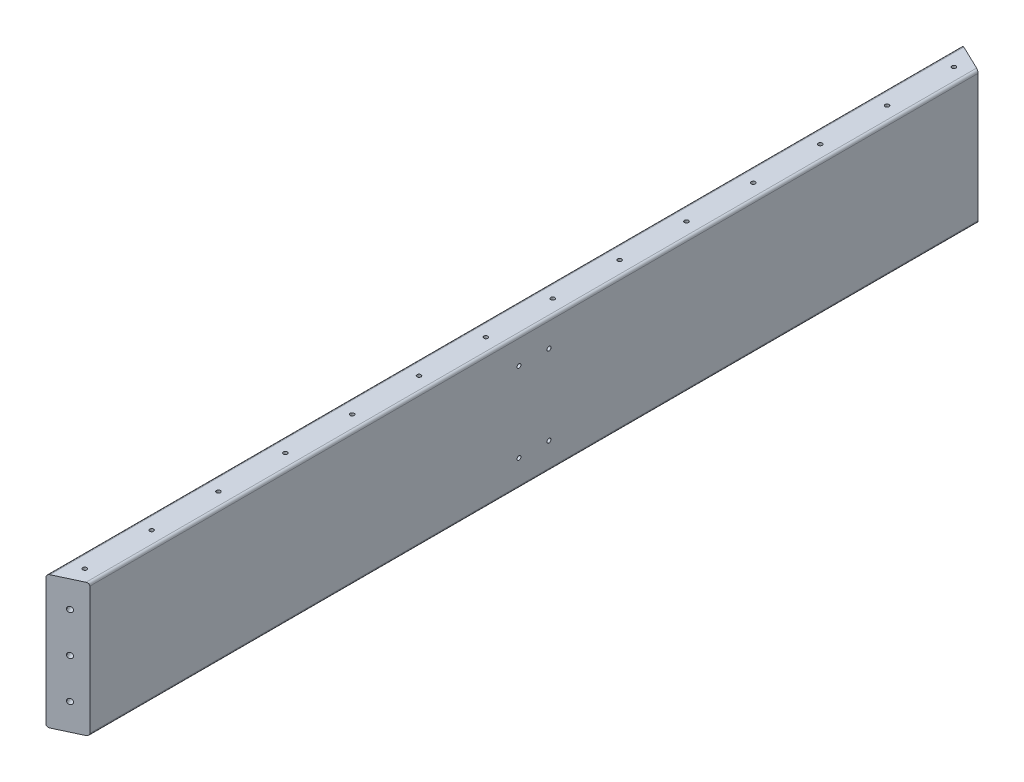
from build123d import *

# Parameters (mm, degrees)
SKETCH1_W                       = 45
SKETCH1_H                       = 200
BOSS_EXTRUDE1_DEPTH             = 1380
FILLET1_R                       = 4
CUT_EXTRUDE2_DEPTH              = 1395.76618373
CUT_EXTRUDE2_DEPTH_BACK         = 1395.76618373
CUT_EXTRUDE3_DEPTH              = 1
SKETCH5_W                       = 1040
SKETCH5_H                       = 12.18939795
CUT_EXTRUDE4_DEPTH              = 5
CUT_EXTRUDE6_DEPTH              = 1395.766183831
CUT_EXTRUDE6_DEPTH_BACK         = 1395.766183831
F_6_0MM_DOWEL_SLOT1_D           = 6
F_6_0MM_DOWEL_SLOT1_DEPTH       = 23.197418143
F_6_0MM_DOWEL_SLOT1_CSINK_D     = 6.05
F_6_0MM_DOWEL_SLOT1_CSINK_ANGLE = 90
F_6_0MM_DOWEL_SLOT1_TIP         = 1.802581857


# Read off the part's stored shape, not the designer's step: Mirror2
with BuildPart() as part:
    # Sketch1 → Boss-Extrude1 (new body)
    with BuildSketch(Plane.XY):
        with Locations((-8.688255411, 34.272684877)):
            Rectangle(SKETCH1_W, SKETCH1_H)
    extrude(amount=BOSS_EXTRUDE1_DEPTH)

    # Fillet1
    fillet1_edges = [part.edges().sort_by_distance(p)[0] for p in [
        (13.811744589, 134.272684877, 690),
        (13.811744589, -65.727315123, 690),
        (-31.188255411, -65.727315123, 690),
        (-31.188255411, 134.272684877, 690),
    ]]
    fillet(fillet1_edges, radius=FILLET1_R)

    # Sketch3 → Cut-Extrude2 (cut, two sides: drawn at the far end of the back side and taken through both)
    with BuildSketch(Plane(origin=(0, 134.272684877, 0), x_dir=(1, 0, 0), z_dir=(0, 1, 0)).offset(-CUT_EXTRUDE2_DEPTH_BACK)):
        Polygon((-2540.235466027, -2557.162450526), (-31.188255411, -1380), (13.811744589, -1358.887479658), (2522.858955205, -181.725029131), (4877.183856257, -5199.819450363), (-185.910564974, -7575.256871758), align=None)
    extrude(amount=CUT_EXTRUDE2_DEPTH + CUT_EXTRUDE2_DEPTH_BACK, mode=Mode.SUBTRACT)

    # Sketch4 → Cut-Extrude3 (cut)
    # profile 1 of 10: a face of its own
    with BuildSketch(Plane.ZY.offset(31.188255411)):
        Polygon((209.169849176, 65.068842021), (189.182870009, 51.344883687), (168.740161676, 16.136550354), (182.711515843, 5.068842021), (124.000578343, 5.068842021), (137.984953343, 17.152175354), (122.945890843, 42.516758687), (109.156828343, 16.136550354), (121.149015843, 5.068842021), (62.477140843, 5.068842021), (75.484953343, 16.136550354), (52.333911676, 53.284987854), (35.328703343, 65.068842021), (95.315682509, 65.068842021), (81.604745009, 53.284987854), (96.930265843, 30.342279521), (110.211515843, 53.284987854), (96.800057509, 65.068842021), (157.620370009, 65.068842021), (143.128182509, 55.277175354), (158.766203343, 32.555821187), (172.125578343, 55.277175354), (160.615161676, 65.068842021), align=None)
    # profile 2 of 10: a face of its own
    with BuildSketch(Plane.ZY.offset(31.188255411)):
        with BuildLine():
            add(Edge.make_bspline(
                [(264.326099176, 66.735508687), (266.189227903, 66.707980657), (269.861125556, 66.65372777), (275.26915309, 66.150572474), (280.495274351, 65.38382248), (285.534693329, 64.27657962), (290.382639072, 62.839432273), (295.053069981, 61.109591829), (299.526819942, 59.048480687), (303.083679686, 57.069242922), (305.790650375, 55.376164216), (307.688829496, 54.067814238), (309.452049225, 52.733194099), (311.093381559, 51.372418159), (312.596750517, 49.985653024), (313.978029894, 48.575152909), (315.212306424, 47.123605596), (316.338320509, 45.659033747), (317.322520534, 44.152878865), (318.160808805, 42.614050033), (318.907091707, 41.062433651), (319.484481342, 39.471506305), (319.94922533, 37.85859476), (320.270814969, 36.216174167), (320.474101215, 34.544449378), (320.498658509, 33.420115885), (320.510995009, 32.855300354)],
                knots=[0, 0, 0, 0, 1.870629373, 3.686680101, 5.449679929, 7.172461936, 8.863314668, 10.523861725, 12.169900943, 13.804909445, 14.607911283, 15.375655432, 16.119264063, 16.828024649, 17.515890728, 18.172441472, 18.809264666, 19.428220604, 20.026654656, 20.613855905, 21.187108478, 21.753895089, 22.311302344, 22.871209158, 23.432945294, 24, 24, 24, 24], degree=3))
            add(Edge.make_bspline(
                [(320.510995009, 32.855300354), (320.498284656, 32.329586723), (320.472985865, 31.283202049), (320.275114115, 29.726136043), (319.931701863, 28.204241908), (319.472053853, 26.706254068), (318.89196957, 25.232621105), (318.147875781, 23.795143936), (317.294273692, 22.375809285), (316.295278658, 20.992036112), (315.172195641, 19.635798815), (313.918278771, 18.306374587), (312.533171949, 17.005338997), (311.023417615, 15.722272405), (309.359690696, 14.497476901), (307.58841739, 13.263170069), (305.675627608, 12.069537072), (302.936694019, 10.526844348), (299.346396048, 8.711044174), (294.810886977, 6.861224241), (290.092614822, 5.260623141), (285.167189764, 3.98402574), (280.056691695, 2.959158768), (274.741243537, 2.255617424), (269.229469352, 1.814187634), (265.485808634, 1.76201435), (263.583911676, 1.735508687)],
                knots=[0, 0, 0, 0, 0.535886334, 1.066632505, 1.596991156, 2.124684857, 2.66290463, 3.20910542, 3.772963408, 4.350121154, 4.947287965, 5.567109047, 6.211950874, 6.883915627, 7.585726949, 8.317291323, 9.084662034, 9.883255442, 11.521815987, 13.182578758, 14.872965808, 16.597765281, 18.366385382, 20.183745168, 22.061222958, 24, 24, 24, 24], degree=3))
            add(Edge.make_bspline(
                [(263.583911676, 1.735508687), (261.716673374, 1.761052498), (258.03323332, 1.811441938), (252.595146569, 2.269782714), (247.325843852, 2.993181321), (242.226128826, 4.001883389), (237.305218505, 5.324131554), (232.550826222, 6.921153297), (227.974555453, 8.832241904), (224.305306248, 10.641226402), (221.525049358, 12.228659397), (219.566143591, 13.424151458), (217.741219479, 14.643059631), (216.062147013, 15.898912747), (214.50000951, 17.159272162), (213.086543348, 18.459285042), (211.800977044, 19.778352384), (210.652532814, 21.122067608), (209.629664775, 22.486754401), (208.760119809, 23.8857084), (208.006173349, 25.293828785), (207.407946386, 26.734919081), (206.934838212, 28.197841854), (206.598254767, 29.688063922), (206.378470837, 31.199441331), (206.355709451, 32.216529429), (206.344328343, 32.725092021)],
                knots=[0, 0, 0, 0, 1.90415575, 3.756265899, 5.561801141, 7.32679303, 9.054558052, 10.755431149, 12.438304469, 14.10920509, 14.924040824, 15.703010382, 16.44950419, 17.161341954, 17.840970712, 18.495796147, 19.118783714, 19.718499511, 20.297533784, 20.8564013, 21.396999339, 21.924813045, 22.445599886, 22.96321623, 23.481589214, 24, 24, 24, 24], degree=3))
            add(Edge.make_bspline(
                [(206.344328343, 32.725092021), (206.354951838, 33.303126758), (206.376030168, 34.450019189), (206.602965272, 36.1496044), (206.914520353, 37.821558238), (207.398509769, 39.458281726), (207.984805784, 41.072238765), (208.745502466, 42.643309668), (209.611205942, 44.192672728), (210.623365762, 45.706651548), (211.758834351, 47.19726042), (213.035675348, 48.652434511), (214.450007013, 50.072454265), (215.984681152, 51.467972035), (217.665866159, 52.82229066), (219.463803932, 54.165216321), (221.420012125, 55.447285142), (224.180150019, 57.158663337), (227.840127609, 59.118230775), (232.452161279, 61.143894604), (237.257577537, 62.89233514), (242.281850532, 64.281942507), (247.501615246, 65.400787681), (252.927595044, 66.166583874), (258.557699387, 66.650504606), (262.380639558, 66.706840077), (264.326099176, 66.735508687)],
                knots=[0, 0, 0, 0, 0.566000994, 1.123015997, 1.677639493, 2.230826392, 2.793269511, 3.358231105, 3.938993238, 4.53108876, 5.140939044, 5.77382598, 6.426367607, 7.103766969, 7.805130735, 8.540850176, 9.301609764, 10.095898195, 11.722665968, 13.363905004, 15.027949392, 16.72841623, 18.467455848, 20.254861266, 22.094132828, 24, 24, 24, 24], degree=3))
        make_face()
        with BuildLine():
            add(Edge.make_bspline(
                [(263.427661676, 56.735508687), (262.662855701, 56.719612589), (261.16235635, 56.688425483), (258.968616765, 56.396208455), (256.879103121, 55.914215716), (254.899188276, 55.235939489), (253.021575316, 54.377176671), (251.264073737, 53.306245653), (249.603277278, 52.057785842), (248.079431933, 50.609893379), (246.683607353, 49.033514321), (245.479688121, 47.313730901), (244.465983425, 45.48681972), (243.619580671, 43.553742361), (242.97499783, 41.505072326), (242.502506736, 39.344604905), (242.228620683, 37.07246286), (242.194864363, 35.52096507), (242.177661676, 34.730300354)],
                knots=[0, 0, 0, 0, 1.068019417, 2.095384312, 3.085239948, 4.059332961, 5.014309867, 5.963726676, 6.929042446, 7.91134787, 8.895298759, 9.865932067, 10.837682145, 11.809829407, 12.808909193, 13.832922564, 14.895627388, 16, 16, 16, 16], degree=3))
            add(Edge.make_bspline(
                [(242.177661676, 34.730300354), (242.194392443, 33.943890735), (242.227128157, 32.405187788), (242.50527584, 30.160735422), (242.958298915, 28.037061152), (243.59942989, 26.030374967), (244.420329781, 24.142260954), (245.409268696, 22.364587383), (246.612871835, 20.729519997), (247.970692222, 19.213346988), (249.480467402, 17.840817777), (251.12774913, 16.657568242), (252.886455842, 15.640845579), (254.767430481, 14.82554492), (256.76393267, 14.180302369), (258.880128058, 13.731537606), (261.115443506, 13.451289652), (262.645559381, 13.418788149), (263.427661676, 13.402175354)],
                knots=[0, 0, 0, 0, 1.111633912, 2.175042541, 3.192181049, 4.178126016, 5.148360161, 6.099125499, 7.048007327, 8.012791551, 8.973017082, 9.926867274, 10.875332242, 11.839940779, 12.820042915, 13.837181423, 14.894498514, 16, 16, 16, 16], degree=3))
            add(Edge.make_bspline(
                [(263.427661676, 13.402175354), (264.214126695, 13.418556325), (265.748628362, 13.450517856), (267.992282569, 13.732888109), (270.117282759, 14.18017181), (272.117420013, 14.822726981), (274.003192374, 15.632034001), (275.758632761, 16.638659129), (277.405961093, 17.818170028), (278.905865932, 19.183382295), (280.263345488, 20.696597077), (281.455806472, 22.336861571), (282.443752251, 24.113403608), (283.278228272, 25.995334403), (283.892042463, 28.014219046), (284.350210602, 30.143149145), (284.628556392, 32.396574075), (284.66102354, 33.939573732), (284.677661676, 34.730300354)],
                knots=[0, 0, 0, 0, 1.110699014, 2.167126888, 3.189404377, 4.174520152, 5.130247132, 6.083235944, 7.027723808, 7.987141777, 8.94245558, 9.895503572, 10.845469305, 11.809266594, 12.798381888, 13.820659378, 14.883173667, 16, 16, 16, 16], degree=3))
            add(Edge.make_bspline(
                [(284.677661676, 34.730300354), (284.662530746, 35.521240076), (284.632912001, 37.069501919), (284.331585729, 39.328932953), (283.882450935, 41.484360847), (283.238244194, 43.531066899), (282.372645433, 45.456962908), (281.365481939, 47.292520289), (280.143806614, 49.003188271), (278.750686728, 50.584337778), (277.226197497, 52.032211184), (275.561849281, 53.279276851), (273.808168856, 54.362930436), (271.939064943, 55.238667062), (269.956704738, 55.900036252), (267.872889094, 56.379898909), (265.68534442, 56.69208543), (264.188290172, 56.7208791), (263.427661676, 56.735508687)],
                knots=[0, 0, 0, 0, 1.105324758, 2.163669494, 3.181353393, 4.181294546, 5.156718352, 6.129306234, 7.104276847, 8.08907606, 9.072228388, 10.038376414, 10.991765335, 11.950124574, 12.917358406, 13.908067456, 14.937123684, 16, 16, 16, 16], degree=3))
        make_face(mode=Mode.SUBTRACT)
    # profile 3 of 10: a face of its own
    with BuildSketch(Plane.ZY.offset(31.188255411)):
        with BuildLine():
            add(Edge.make_bspline(
                [(384.326099176, 66.735508687), (386.189227903, 66.707980657), (389.861125556, 66.65372777), (395.26915309, 66.150572474), (400.495274351, 65.38382248), (405.534693329, 64.27657962), (410.382639072, 62.839432273), (415.053069981, 61.109591829), (419.526819942, 59.048480687), (423.083679686, 57.069242922), (425.790650375, 55.376164216), (427.688829496, 54.067814238), (429.452049225, 52.733194099), (431.093381559, 51.372418159), (432.596750517, 49.985653024), (433.978029894, 48.575152909), (435.212306424, 47.123605596), (436.338320509, 45.659033747), (437.322520534, 44.152878865), (438.160808805, 42.614050033), (438.907091707, 41.062433651), (439.484481342, 39.471506305), (439.94922533, 37.85859476), (440.270814969, 36.216174167), (440.474101215, 34.544449378), (440.498658509, 33.420115885), (440.510995009, 32.855300354)],
                knots=[0, 0, 0, 0, 1.870629373, 3.686680101, 5.449679929, 7.172461936, 8.863314668, 10.523861725, 12.169900943, 13.804909445, 14.607911283, 15.375655432, 16.119264063, 16.828024649, 17.515890728, 18.172441472, 18.809264666, 19.428220604, 20.026654656, 20.613855905, 21.187108478, 21.753895089, 22.311302344, 22.871209158, 23.432945294, 24, 24, 24, 24], degree=3))
            add(Edge.make_bspline(
                [(440.510995009, 32.855300354), (440.498284656, 32.329586723), (440.472985865, 31.283202049), (440.275114115, 29.726136043), (439.931701863, 28.204241908), (439.472053853, 26.706254068), (438.89196957, 25.232621105), (438.147875781, 23.795143936), (437.294273692, 22.375809285), (436.295278658, 20.992036112), (435.172195641, 19.635798815), (433.918278771, 18.306374587), (432.533171949, 17.005338997), (431.023417615, 15.722272405), (429.359690696, 14.497476901), (427.58841739, 13.263170069), (425.675627608, 12.069537072), (422.936694019, 10.526844348), (419.346396048, 8.711044174), (414.810886977, 6.861224241), (410.092614822, 5.260623141), (405.167189764, 3.98402574), (400.056691695, 2.959158768), (394.741243537, 2.255617424), (389.229469352, 1.814187634), (385.485808634, 1.76201435), (383.583911676, 1.735508687)],
                knots=[0, 0, 0, 0, 0.535886334, 1.066632505, 1.596991156, 2.124684857, 2.66290463, 3.20910542, 3.772963408, 4.350121154, 4.947287965, 5.567109047, 6.211950874, 6.883915627, 7.585726949, 8.317291323, 9.084662034, 9.883255442, 11.521815987, 13.182578758, 14.872965808, 16.597765281, 18.366385382, 20.183745168, 22.061222958, 24, 24, 24, 24], degree=3))
            add(Edge.make_bspline(
                [(383.583911676, 1.735508687), (381.716673374, 1.761052498), (378.03323332, 1.811441938), (372.595146569, 2.269782714), (367.325843852, 2.993181321), (362.226128826, 4.001883389), (357.305218505, 5.324131554), (352.550826222, 6.921153297), (347.974555453, 8.832241904), (344.305306248, 10.641226402), (341.525049358, 12.228659397), (339.566143591, 13.424151458), (337.741219479, 14.643059631), (336.062147013, 15.898912747), (334.50000951, 17.159272162), (333.086543348, 18.459285042), (331.800977044, 19.778352384), (330.652532814, 21.122067608), (329.629664775, 22.486754401), (328.760119809, 23.8857084), (328.006173349, 25.293828785), (327.407946386, 26.734919081), (326.934838212, 28.197841854), (326.598254767, 29.688063922), (326.378470837, 31.199441331), (326.355709451, 32.216529429), (326.344328343, 32.725092021)],
                knots=[0, 0, 0, 0, 1.90415575, 3.756265899, 5.561801141, 7.32679303, 9.054558052, 10.755431149, 12.438304469, 14.10920509, 14.924040824, 15.703010382, 16.44950419, 17.161341954, 17.840970712, 18.495796147, 19.118783714, 19.718499511, 20.297533784, 20.8564013, 21.396999339, 21.924813045, 22.445599886, 22.96321623, 23.481589214, 24, 24, 24, 24], degree=3))
            add(Edge.make_bspline(
                [(326.344328343, 32.725092021), (326.354951838, 33.303126758), (326.376030168, 34.450019189), (326.602965272, 36.1496044), (326.914520353, 37.821558238), (327.398509769, 39.458281726), (327.984805784, 41.072238765), (328.745502466, 42.643309668), (329.611205942, 44.192672728), (330.623365762, 45.706651548), (331.758834351, 47.19726042), (333.035675348, 48.652434511), (334.450007013, 50.072454265), (335.984681152, 51.467972035), (337.665866159, 52.82229066), (339.463803932, 54.165216321), (341.420012125, 55.447285142), (344.180150019, 57.158663337), (347.840127609, 59.118230775), (352.452161279, 61.143894604), (357.257577537, 62.89233514), (362.281850532, 64.281942507), (367.501615246, 65.400787681), (372.927595044, 66.166583874), (378.557699387, 66.650504606), (382.380639558, 66.706840077), (384.326099176, 66.735508687)],
                knots=[0, 0, 0, 0, 0.566000994, 1.123015997, 1.677639493, 2.230826392, 2.793269511, 3.358231105, 3.938993238, 4.53108876, 5.140939044, 5.77382598, 6.426367607, 7.103766969, 7.805130735, 8.540850176, 9.301609764, 10.095898195, 11.722665968, 13.363905004, 15.027949392, 16.72841623, 18.467455848, 20.254861266, 22.094132828, 24, 24, 24, 24], degree=3))
        make_face()
        with BuildLine():
            add(Edge.make_bspline(
                [(383.427661676, 56.735508687), (382.662855701, 56.719612589), (381.16235635, 56.688425483), (378.968616765, 56.396208455), (376.879103121, 55.914215716), (374.899188276, 55.235939489), (373.021575316, 54.377176671), (371.264073737, 53.306245653), (369.603277278, 52.057785842), (368.079431933, 50.609893379), (366.683607353, 49.033514321), (365.479688121, 47.313730901), (364.465983425, 45.48681972), (363.619580671, 43.553742361), (362.97499783, 41.505072326), (362.502506736, 39.344604905), (362.228620683, 37.07246286), (362.194864363, 35.52096507), (362.177661676, 34.730300354)],
                knots=[0, 0, 0, 0, 1.068019417, 2.095384312, 3.085239948, 4.059332961, 5.014309867, 5.963726676, 6.929042446, 7.91134787, 8.895298759, 9.865932067, 10.837682145, 11.809829407, 12.808909193, 13.832922564, 14.895627388, 16, 16, 16, 16], degree=3))
            add(Edge.make_bspline(
                [(362.177661676, 34.730300354), (362.194392443, 33.943890735), (362.227128157, 32.405187788), (362.50527584, 30.160735422), (362.958298915, 28.037061152), (363.59942989, 26.030374967), (364.420329781, 24.142260954), (365.409268696, 22.364587383), (366.612871835, 20.729519997), (367.970692222, 19.213346988), (369.480467402, 17.840817777), (371.12774913, 16.657568242), (372.886455842, 15.640845579), (374.767430481, 14.82554492), (376.76393267, 14.180302369), (378.880128058, 13.731537606), (381.115443506, 13.451289652), (382.645559381, 13.418788149), (383.427661676, 13.402175354)],
                knots=[0, 0, 0, 0, 1.111633912, 2.175042541, 3.192181049, 4.178126016, 5.148360161, 6.099125499, 7.048007327, 8.012791551, 8.973017082, 9.926867274, 10.875332242, 11.839940779, 12.820042915, 13.837181423, 14.894498514, 16, 16, 16, 16], degree=3))
            add(Edge.make_bspline(
                [(383.427661676, 13.402175354), (384.214126695, 13.418556325), (385.748628362, 13.450517856), (387.992282569, 13.732888109), (390.117282759, 14.18017181), (392.117420013, 14.822726981), (394.003192374, 15.632034001), (395.758632761, 16.638659129), (397.405961093, 17.818170028), (398.905865932, 19.183382295), (400.263345488, 20.696597077), (401.455806472, 22.336861571), (402.443752251, 24.113403608), (403.278228272, 25.995334403), (403.892042463, 28.014219046), (404.350210602, 30.143149145), (404.628556392, 32.396574075), (404.66102354, 33.939573732), (404.677661676, 34.730300354)],
                knots=[0, 0, 0, 0, 1.110699014, 2.167126888, 3.189404377, 4.174520152, 5.130247132, 6.083235944, 7.027723808, 7.987141777, 8.94245558, 9.895503572, 10.845469305, 11.809266594, 12.798381888, 13.820659378, 14.883173667, 16, 16, 16, 16], degree=3))
            add(Edge.make_bspline(
                [(404.677661676, 34.730300354), (404.662530746, 35.521240076), (404.632912001, 37.069501919), (404.331585729, 39.328932953), (403.882450935, 41.484360847), (403.238244194, 43.531066899), (402.372645433, 45.456962908), (401.365481939, 47.292520289), (400.143806614, 49.003188271), (398.750686728, 50.584337778), (397.226197497, 52.032211184), (395.561849281, 53.279276851), (393.808168856, 54.362930436), (391.939064943, 55.238667062), (389.956704738, 55.900036252), (387.872889094, 56.379898909), (385.68534442, 56.69208543), (384.188290172, 56.7208791), (383.427661676, 56.735508687)],
                knots=[0, 0, 0, 0, 1.105324758, 2.163669494, 3.181353393, 4.181294546, 5.156718352, 6.129306234, 7.104276847, 8.08907606, 9.072228388, 10.038376414, 10.991765335, 11.950124574, 12.917358406, 13.908067456, 14.937123684, 16, 16, 16, 16], degree=3))
        make_face(mode=Mode.SUBTRACT)
    # profile 4 of 10: a face of its own
    with BuildSketch(Plane.ZY.offset(31.188255411)):
        with BuildLine():
            Line((443.492765843, 65.068842021), (522.190682509, 65.068842021))
            add(Edge.make_bspline(
                [(522.190682509, 65.068842021), (523.293178189, 65.065104661), (525.433474218, 65.057849254), (528.555008138, 64.965724661), (531.489675525, 64.810502582), (534.246256318, 64.600623025), (536.823644946, 64.352669886), (539.215278292, 64.010283745), (541.425873143, 63.620143205), (544.145037082, 63.038943314), (547.41324665, 62.03981434), (551.248647502, 60.491777115), (555.037029754, 58.525086517), (557.455088082, 56.951802983), (558.688078343, 56.149571187)],
                knots=[0, 0, 0, 0, 1.037536368, 2.014189271, 2.938623327, 3.802961405, 4.615839976, 5.374884088, 6.075983965, 6.728149891, 7.990680596, 9.286214146, 10.616215543, 12, 12, 12, 12], degree=3))
            add(Edge.make_bspline(
                [(558.688078343, 56.149571187), (559.26889564, 55.737725161), (560.412148874, 54.927066966), (562.034480024, 53.651002587), (563.54801046, 52.36295854), (564.948887779, 51.056809832), (566.231869726, 49.732807509), (567.414933291, 48.398902163), (568.480756052, 47.04747464), (569.440277117, 45.677757705), (570.266965829, 44.282782297), (571.004977291, 42.882531096), (571.634858233, 41.468436912), (572.12842296, 40.023412583), (572.517137774, 38.569758891), (572.809683538, 37.100867465), (572.983442856, 35.615626299), (573.001802151, 34.61790149), (573.010995009, 34.118321187)],
                knots=[0, 0, 0, 0, 1.249054469, 2.458579603, 3.619872382, 4.735112552, 5.81752881, 6.853380763, 7.86188952, 8.835705453, 9.785129533, 10.704770048, 11.611712122, 12.497925602, 13.380861412, 14.250029463, 15.123755567, 16, 16, 16, 16], degree=3))
            add(Edge.make_bspline(
                [(573.010995009, 34.118321187), (573.003751182, 33.588149977), (572.989396746, 32.537557714), (572.790132634, 30.981444626), (572.516040435, 29.459310402), (572.099495184, 27.979298366), (571.601635507, 26.526668908), (570.953237291, 25.123164306), (570.211693877, 23.749052709), (569.350155537, 22.412937303), (568.353730689, 21.134242756), (567.267862885, 19.869261323), (566.06049972, 18.648468691), (564.721117851, 17.481262632), (563.290187002, 16.328983243), (561.73597683, 15.224002112), (560.06691241, 14.155765671), (557.666760458, 12.777462214), (554.463201159, 11.179890898), (550.359588051, 9.539705264), (545.980290655, 8.16951812), (541.338174357, 7.019796552), (536.418256861, 6.140345746), (531.226714689, 5.526987488), (525.764217343, 5.141751251), (522.030751102, 5.093521004), (520.120370009, 5.068842021)],
                knots=[0, 0, 0, 0, 0.57437755, 1.138191963, 1.698381788, 2.249747293, 2.803357062, 3.361408448, 3.92359075, 4.495263514, 5.082544895, 5.679696615, 6.301906837, 6.941991075, 7.604846679, 8.29297448, 9.008269995, 9.752421165, 11.292811579, 12.884851517, 14.538218337, 16.263790688, 18.066384255, 19.952737707, 21.92905229, 24, 24, 24, 24], degree=3))
            Line((520.120370009, 5.068842021), (443.492765843, 5.068842021))
            Line((443.492765843, 5.068842021), (465.510995009, 18.805821187))
            Line((465.510995009, 18.805821187), (465.510995009, 51.162592021))
            Line((465.510995009, 51.162592021), (443.492765843, 65.068842021))
        make_face()
        with BuildLine():
            Line((496.344328343, 16.735508687), (511.070890843, 16.735508687))
            add(Edge.make_bspline(
                [(511.070890843, 16.735508687), (512.329699209, 16.745064771), (514.735531377, 16.763328339), (518.18068647, 16.912044251), (521.289869154, 17.188067913), (524.074907712, 17.536182108), (526.528754627, 18.01427895), (528.662162707, 18.589885512), (530.471434238, 19.268392613), (531.991682458, 20.070388675), (533.242866553, 21.073398949), (534.312703567, 22.264130557), (535.212045813, 23.673101279), (535.94407692, 25.296130043), (536.493518615, 27.13275332), (536.891199575, 29.178029579), (537.141156529, 31.434212429), (537.165161558, 33.010857686), (537.177661676, 33.831862854)],
                knots=[0, 0, 0, 0, 1.64779172, 3.149256418, 4.512366556, 5.732937362, 6.821548936, 7.782276976, 8.622159497, 9.346745673, 10.021984238, 10.709915122, 11.433275169, 12.20111891, 13.033201691, 13.936846005, 14.925655543, 16, 16, 16, 16], degree=3))
            add(Edge.make_bspline(
                [(537.177661676, 33.831862854), (537.157841538, 34.657430346), (537.119418626, 36.257858488), (536.817501244, 38.583472107), (536.312651217, 40.747594934), (535.61512438, 42.759199676), (534.688960756, 44.598395789), (533.584083373, 46.288835145), (532.265517293, 47.815740533), (530.741406454, 49.178961537), (529.009470796, 50.376152365), (527.082927811, 51.426147176), (524.94704649, 52.290116207), (522.620079529, 53.004955218), (520.094080024, 53.560940147), (517.366436971, 53.961710372), (514.434305533, 54.193098126), (512.412453546, 54.221084315), (511.370370009, 54.235508687)],
                knots=[0, 0, 0, 0, 1.053932644, 2.043132125, 2.988170456, 3.887375669, 4.754852068, 5.611030817, 6.459823452, 7.323253996, 8.214964486, 9.142484795, 10.119185202, 11.151698555, 12.247550536, 13.418522366, 14.669479586, 16, 16, 16, 16], degree=3))
            Line((511.370370009, 54.235508687), (496.344328343, 54.235508687))
            Line((496.344328343, 54.235508687), (496.344328343, 16.735508687))
        make_face(mode=Mode.SUBTRACT)
    # profile 5 of 10: a face of its own
    with BuildSketch(Plane.ZY.offset(31.188255411)):
        with BuildLine():
            Line((576.826099176, 65.068842021), (655.953703343, 65.068842021))
            add(Edge.make_bspline(
                [(655.953703343, 65.068842021), (657.486320072, 65.053416713), (660.484912737, 65.023236815), (664.872939517, 64.727159612), (669.054926719, 64.268278826), (673.02339065, 63.605393817), (676.781186129, 62.763771501), (680.327745784, 61.734889536), (683.66495648, 60.518251955), (686.281849273, 59.324247555), (688.243733753, 58.291933443), (689.611837499, 57.503081246), (690.879739479, 56.674038566), (692.065185984, 55.837189674), (693.148328892, 54.958689669), (694.142547994, 54.06586894), (695.029329186, 53.130639274), (695.841342081, 52.187771998), (696.550639494, 51.202722618), (697.157243976, 50.188689827), (697.687070916, 49.158113066), (698.106809546, 48.092890701), (698.422818608, 47.000740349), (698.687691396, 45.887181589), (698.805797049, 44.741511794), (698.831459372, 43.970905503), (698.844328343, 43.584467021)],
                knots=[0, 0, 0, 0, 2.105049813, 4.118568463, 6.038489211, 7.882189377, 9.642475769, 11.32546917, 12.951418585, 14.517567808, 15.272314675, 15.99631609, 16.68591711, 17.352664789, 17.98863279, 18.600645991, 19.186788513, 19.757817292, 20.308823715, 20.851771583, 21.379715788, 21.898970077, 22.42150002, 22.940788537, 23.468833728, 24, 24, 24, 24], degree=3))
            add(Edge.make_bspline(
                [(698.844328343, 43.584467021), (698.817241562, 42.878237154), (698.764069365, 41.491885875), (698.254129644, 39.479132409), (697.458001507, 37.579268776), (696.315655133, 35.80173951), (694.84885596, 34.153642968), (693.070627146, 32.625825825), (690.979929747, 31.215844139), (688.582020531, 29.942794219), (685.914065525, 28.786260152), (682.986444065, 27.789077961), (679.814331426, 26.945248946), (676.398521863, 26.267266979), (672.745701314, 25.712992596), (668.845715591, 25.35322958), (664.702484512, 25.108931552), (661.856865226, 25.082454853), (660.393807509, 25.068842021)],
                knots=[0, 0, 0, 0, 0.721701506, 1.41672259, 2.111516441, 2.822652028, 3.568681228, 4.36236042, 5.216309961, 6.14459493, 7.137493147, 8.189830915, 9.30738106, 10.494965799, 11.752859852, 13.087483236, 14.502547355, 16, 16, 16, 16], degree=3))
            Line((660.393807509, 25.068842021), (629.677661676, 25.068842021))
            Line((629.677661676, 25.068842021), (629.677661676, 19.274571187))
            Line((629.677661676, 19.274571187), (651.656828343, 5.068842021))
            Line((651.656828343, 5.068842021), (576.826099176, 5.068842021))
            Line((576.826099176, 5.068842021), (598.844328343, 19.274571187))
            Line((598.844328343, 19.274571187), (598.844328343, 51.136550354))
            Line((598.844328343, 51.136550354), (576.826099176, 65.068842021))
        make_face()
        with BuildLine():
            Line((629.677661676, 36.735508687), (652.529224176, 36.735508687))
            add(Edge.make_bspline(
                [(652.529224176, 36.735508687), (653.154417295, 36.73820209), (654.353454026, 36.743367677), (656.076499067, 36.845911487), (657.65115886, 36.960833958), (659.07545196, 37.161603219), (660.357684266, 37.397746079), (661.485749371, 37.714663782), (662.475850384, 38.052908688), (663.313330544, 38.479119839), (664.0416665, 38.97116023), (664.661341388, 39.551491435), (665.183833879, 40.22597889), (665.614021229, 40.978332955), (665.936471956, 41.832864817), (666.188698479, 42.759952968), (666.309799138, 43.785367788), (666.33247274, 44.491359066), (666.344328343, 44.860508687)],
                knots=[0, 0, 0, 0, 1.627966544, 3.122221958, 4.494697369, 5.738471256, 6.866914578, 7.88711769, 8.7882005, 9.586970752, 10.326944841, 11.070708394, 11.787525129, 12.541865667, 13.318574242, 14.160341201, 15.038076858, 16, 16, 16, 16], degree=3))
            add(Edge.make_bspline(
                [(666.344328343, 44.860508687), (666.334180262, 45.203835296), (666.314287871, 45.876828282), (666.163319443, 46.855358217), (665.87987571, 47.759757304), (665.521648137, 48.60900068), (665.028232053, 49.37434397), (664.457894133, 50.093804367), (663.749037595, 50.714862593), (662.958541173, 51.294933562), (662.041649323, 51.786172038), (661.033864685, 52.228854938), (659.911702201, 52.592411606), (658.692102949, 52.88660292), (657.365855957, 53.120885104), (655.935874332, 53.290610466), (654.396526553, 53.374055322), (653.336593424, 53.392603843), (652.789640843, 53.402175354)],
                knots=[0, 0, 0, 0, 0.910007037, 1.783806841, 2.613556051, 3.417214628, 4.218399135, 5.019748818, 5.842369397, 6.707645606, 7.61386336, 8.592746744, 9.62230475, 10.735613351, 11.915859863, 13.19014394, 14.550042466, 16, 16, 16, 16], degree=3))
            Line((652.789640843, 53.402175354), (629.677661676, 53.402175354))
            Line((629.677661676, 53.402175354), (629.677661676, 36.735508687))
        make_face(mode=Mode.SUBTRACT)
    # profile 6 of 10: a face of its own
    with BuildSketch(Plane.ZY.offset(31.188255411)):
        Polygon((818.010995009, 65.068842021), (818.010995009, 38.844883687), (795.550057509, 55.068842021), (753.010995009, 55.068842021), (753.010995009, 41.735508687), (776.396411676, 41.735508687), (793.010995009, 49.352696187), (793.010995009, 21.852696187), (776.396411676, 30.068842021), (753.010995009, 30.068842021), (753.010995009, 16.735508687), (795.550057509, 16.735508687), (819.677661676, 33.962071187), (819.677661676, 5.068842021), (700.159432509, 5.068842021), (722.177661676, 18.766758687), (722.177661676, 51.253737854), (700.159432509, 65.068842021), align=None)
    # profile 7 of 10: a face of its own
    with BuildSketch(Plane.ZY.offset(31.188255411)):
        with BuildLine():
            Line((935.510995009, 66.084467021), (935.510995009, 38.180821187))
            add(Edge.make_bspline(
                [(935.510995009, 38.180821187), (934.926387354, 38.905649198), (933.763318111, 40.347684994), (931.845724847, 42.350553648), (929.836754932, 44.230750831), (927.695318403, 45.947519308), (925.47641531, 47.562195135), (923.117881812, 49.005100821), (920.655158299, 50.317925183), (918.091782945, 51.511823188), (915.404201563, 52.530508094), (912.6214739, 53.455557767), (909.71114474, 54.196826985), (906.701892771, 54.828398292), (903.579973085, 55.303919739), (900.348354067, 55.65665228), (897.002577208, 55.868555712), (894.734390248, 55.890861384), (893.583911676, 55.902175354)],
                knots=[0, 0, 0, 0, 0.946210828, 1.882474, 2.815915731, 3.741314916, 4.670670766, 5.603695327, 6.549165255, 7.506583431, 8.475882905, 9.469282938, 10.485896633, 11.526843182, 12.593876876, 13.694522957, 14.830607007, 16, 16, 16, 16], degree=3))
            add(Edge.make_bspline(
                [(893.583911676, 55.902175354), (892.450619495, 55.889176448), (890.254924544, 55.86399174), (887.067648632, 55.613611964), (884.101173288, 55.203951671), (881.350936094, 54.631689622), (878.816242805, 53.911616143), (876.497841711, 53.015634149), (874.40405973, 51.945108512), (872.521600701, 50.720484213), (870.866698724, 49.313304681), (869.423237376, 47.749164127), (868.21458178, 46.005296915), (867.221083448, 44.107731027), (866.447160809, 42.043342376), (865.912861777, 39.817057836), (865.558157941, 37.43261105), (865.527025827, 35.786343842), (865.510995009, 34.938633687)],
                knots=[0, 0, 0, 0, 1.361526538, 2.637887207, 3.838606771, 4.957579928, 6.010636943, 7.001387485, 7.939021657, 8.83149138, 9.693578116, 10.542550991, 11.381663369, 12.235444155, 13.110137342, 14.023378089, 14.982180744, 16, 16, 16, 16], degree=3))
            add(Edge.make_bspline(
                [(865.510995009, 34.938633687), (865.530349527, 34.090726211), (865.567863365, 32.44727203), (865.945514463, 30.082217484), (866.521399959, 27.890489923), (867.361211592, 25.885570578), (868.433507749, 24.050801624), (869.765216545, 22.416151483), (871.318287096, 20.950380477), (873.130997499, 19.676027482), (875.215923092, 18.584278647), (877.573700725, 17.639364815), (880.220911665, 16.829349166), (883.164639952, 16.200833224), (886.396169888, 15.671960018), (889.922769833, 15.319932852), (893.742069537, 15.116649339), (896.383128608, 15.085150855), (897.750578343, 15.068842021)],
                knots=[0, 0, 0, 0, 0.942106099, 1.826034385, 2.656094526, 3.456497988, 4.235368595, 5.010957713, 5.792813081, 6.602949612, 7.466551927, 8.4039861, 9.423760577, 10.540850867, 11.748446455, 13.063302589, 14.47947888, 16, 16, 16, 16], degree=3))
            add(Edge.make_bspline(
                [(897.750578343, 15.068842021), (899.061784587, 15.081883473), (901.630215109, 15.107429464), (905.396781542, 15.364856503), (909.000715161, 15.758857131), (912.43406832, 16.331975391), (915.705596615, 17.057299185), (918.801904086, 17.95385003), (921.736266668, 19.008997939), (924.46852262, 20.219538842), (926.954490902, 21.537440468), (929.115603757, 22.955438168), (930.938743009, 24.438467362), (932.405356193, 26.007403724), (933.525933745, 27.656860183), (934.301950118, 29.38427988), (934.713648969, 31.20401034), (934.689707918, 32.432488544), (934.677661676, 33.050612854)],
                knots=[0, 0, 0, 0, 1.402726314, 2.747702809, 4.037471048, 5.280364341, 6.470102412, 7.620855566, 8.727004207, 9.803942215, 10.815763112, 11.734099946, 12.565340187, 13.32445359, 14.023830686, 14.689137373, 15.340422928, 16, 16, 16, 16], degree=3))
            add(Edge.make_bspline(
                [(934.677661676, 33.050612854), (934.65475122, 33.175359159), (934.597929601, 33.48475007), (934.403232171, 33.734747583), (934.287036676, 33.883946187)],
                knots=[0, 0, 0, 0, 0.806399288, 2, 2, 2, 2], degree=3))
            add(Edge.make_bspline(
                [(934.287036676, 33.883946187), (934.649285884, 33.66299838), (935.354037331, 33.233147098), (936.27650514, 32.455981875), (937.074190417, 31.627660463), (937.735605652, 30.72740474), (938.228732591, 29.741907691), (938.582635558, 28.694600691), (938.815862689, 27.583464788), (938.834716975, 26.814834236), (938.844328343, 26.423008687)],
                knots=[0, 0, 0, 0, 1.105509158, 2.150754673, 3.13582401, 4.100642831, 5.052620013, 5.997907561, 6.979391378, 8, 8, 8, 8], degree=3))
            add(Edge.make_bspline(
                [(938.844328343, 26.423008687), (938.834601453, 25.966822626), (938.815367315, 25.064751559), (938.653185289, 23.727924866), (938.392630781, 22.421918096), (938.032290021, 21.14818375), (937.552934694, 19.910420307), (936.985336019, 18.707970732), (936.315174888, 17.533546636), (935.527962018, 16.402796513), (934.643786276, 15.294998492), (933.651057188, 14.224738491), (932.549646202, 13.200859922), (931.365363292, 12.18729892), (930.055560228, 11.23080288), (928.653889882, 10.294228493), (927.145470048, 9.391382091), (924.977658107, 8.223489898), (922.071683096, 6.875511254), (918.341619835, 5.4995021), (914.356446489, 4.3309114), (910.105463266, 3.38538782), (905.596857558, 2.648053622), (900.824788285, 2.122914331), (895.793582345, 1.787927141), (892.351823239, 1.753262333), (890.589120009, 1.735508687)],
                knots=[0, 0, 0, 0, 0.552058771, 1.091651601, 1.627445518, 2.162930235, 2.691775597, 3.232313983, 3.771241375, 4.326490976, 4.898393428, 5.485796368, 6.091636368, 6.71793022, 7.371527852, 8.053482174, 8.758091527, 9.498592092, 11.033537906, 12.631109767, 14.306895306, 16.056953907, 17.899302752, 19.834254757, 21.866505944, 24, 24, 24, 24], degree=3))
            add(Edge.make_bspline(
                [(890.589120009, 1.735508687), (888.548451985, 1.762453872), (884.531926072, 1.815488483), (878.615672817, 2.250570734), (872.917129827, 2.976217525), (867.434365225, 3.990592339), (862.167036449, 5.288891398), (857.116442466, 6.877370407), (852.280937411, 8.754288163), (848.435993351, 10.564234229), (845.521319696, 12.137907726), (843.471366535, 13.32748575), (841.576659986, 14.569404031), (839.805558313, 15.813823391), (838.196356854, 17.105932995), (836.712211393, 18.411261679), (835.370379223, 19.744995155), (834.181578237, 21.122068611), (833.118997631, 22.518716623), (832.19366919, 23.942983531), (831.419899589, 25.405020242), (830.777237655, 26.88185002), (830.293407509, 28.397527002), (829.945473049, 29.9352951), (829.707758749, 31.502457608), (829.68771886, 32.559293522), (829.677661676, 33.089675354)],
                knots=[0, 0, 0, 0, 1.976278068, 3.889790979, 5.74182791, 7.537568822, 9.287114493, 10.992867342, 12.661877517, 14.307263339, 15.104736675, 15.869682266, 16.601910088, 17.29826597, 17.965277392, 18.599589878, 19.211917011, 19.796003865, 20.36014548, 20.910508645, 21.438938455, 21.960552572, 22.468382688, 22.977238285, 23.486718586, 24, 24, 24, 24], degree=3))
            add(Edge.make_bspline(
                [(829.677661676, 33.089675354), (829.687861872, 33.628719201), (829.708267891, 34.707104318), (829.945911006, 36.308699354), (830.293553658, 37.895583853), (830.791202796, 39.459730007), (831.431495011, 41.001896419), (832.219723912, 42.512226041), (833.134513104, 44.01012817), (834.207086402, 45.473013277), (835.410530463, 46.930309501), (836.76664031, 48.353231526), (838.253666326, 49.76568011), (839.890299155, 51.143887777), (841.659431529, 52.512685391), (843.575560414, 53.848598594), (845.629710463, 55.169343494), (848.554088903, 56.89763378), (852.386402495, 58.893312467), (857.152354323, 61.004189773), (862.080245631, 62.772108464), (867.158496193, 64.215696527), (872.380344655, 65.355191948), (877.756644083, 66.154854228), (883.288028573, 66.651369346), (887.029040267, 66.70723419), (888.922453343, 66.735508687)],
                knots=[0, 0, 0, 0, 0.525007891, 1.05030546, 1.574784702, 2.107289821, 2.647817534, 3.200314585, 3.766253237, 4.356903922, 4.966814807, 5.607228748, 6.27156493, 6.964914833, 7.691785098, 8.451132758, 9.240888444, 10.071629194, 11.761398921, 13.449075542, 15.148556199, 16.859905886, 18.591667901, 20.354257569, 22.154804915, 24, 24, 24, 24], degree=3))
            add(Edge.make_bspline(
                [(888.922453343, 66.735508687), (890.554860908, 66.710910957), (893.779507455, 66.66232077), (898.543877996, 66.339801076), (903.165623381, 65.771590696), (907.650298592, 65.015155621), (911.992980604, 64.010636454), (916.191761604, 62.776421992), (920.267344636, 61.369428454), (922.875176928, 60.213180155), (924.169849176, 59.639154521)],
                knots=[0, 0, 0, 0, 1.081234992, 2.135864081, 3.161024119, 4.164395756, 5.146964068, 6.111287528, 7.062338621, 8, 8, 8, 8], degree=3))
            Line((924.169849176, 59.639154521), (935.510995009, 66.084467021))
        make_face()
    # profile 8 of 10: a face of its own
    with BuildSketch(Plane.ZY.offset(31.188255411)):
        Polygon((1080.680265843, 65.068842021), (1040.341724176, 43.753737854), (1061.292245009, 19.196446187), (1081.682870009, 5.068842021), (1013.128182509, 5.068842021), (1031.240161676, 18.167800354), (1018.896411676, 32.373529521), (995.510995009, 21.618321187), (995.510995009, 19.196446187), (1012.125578343, 5.068842021), (942.659432509, 5.068842021), (964.677661676, 19.196446187), (964.677661676, 51.344883687), (942.659432509, 65.068842021), (1011.422453343, 65.068842021), (995.510995009, 52.295404521), (995.510995009, 35.784987854), (1030.003182509, 53.284987854), (1014.625578343, 65.068842021), align=None)
    # profile 9 of 10: a face of its own
    with BuildSketch(Plane.ZY.offset(31.188255411)):
        Polygon((1198.844328343, 65.068842021), (1198.844328343, 38.844883687), (1176.383390843, 55.068842021), (1133.844328343, 55.068842021), (1133.844328343, 41.735508687), (1157.229745009, 41.735508687), (1173.844328343, 49.352696187), (1173.844328343, 21.852696187), (1157.229745009, 30.068842021), (1133.844328343, 30.068842021), (1133.844328343, 16.735508687), (1176.383390843, 16.735508687), (1200.510995009, 33.962071187), (1200.510995009, 5.068842021), (1080.992765843, 5.068842021), (1103.010995009, 18.766758687), (1103.010995009, 51.253737854), (1080.992765843, 65.068842021), align=None)
    # profile 10 of 10: a face of its own
    with BuildSketch(Plane.ZY.offset(31.188255411)):
        with BuildLine():
            Line((1208.492765843, 65.068842021), (1281.031828343, 65.068842021))
            Line((1281.031828343, 65.068842021), (1292.021411676, 65.068842021))
            Line((1292.021411676, 65.068842021), (1306.083911676, 64.157383687))
            add(Edge.make_bspline(
                [(1306.083911676, 64.157383687), (1306.940169374, 64.039256794), (1308.615319272, 63.808157846), (1311.058281216, 63.337563855), (1313.380354851, 62.767687839), (1315.578731685, 62.089935294), (1317.657035758, 61.326694948), (1319.605316455, 60.450470611), (1321.42875132, 59.476377374), (1323.114534651, 58.411174428), (1324.650139759, 57.29411641), (1325.987877633, 56.102372235), (1327.124872866, 54.872788804), (1328.053928973, 53.592858454), (1328.777675156, 52.267462723), (1329.307994984, 50.895646863), (1329.614223846, 49.470316631), (1329.65646074, 48.507739608), (1329.677661676, 48.024571187)],
                knots=[0, 0, 0, 0, 1.340877066, 2.623240742, 3.857954313, 5.048638494, 6.190666904, 7.290790941, 8.360296274, 9.395305173, 10.382529586, 11.303008656, 12.170455577, 12.975967566, 13.750396599, 14.507025734, 15.250597095, 16, 16, 16, 16], degree=3))
            add(Edge.make_bspline(
                [(1329.677661676, 48.024571187), (1329.656701995, 47.562996638), (1329.615125807, 46.647404889), (1329.310828233, 45.308381486), (1328.792347725, 44.042366604), (1328.075670134, 42.841757994), (1327.159403342, 41.70233838), (1326.017861937, 40.650181058), (1324.702098413, 39.643556268), (1323.174623225, 38.719270636), (1321.445177786, 37.865539707), (1319.521240304, 37.05796089), (1317.390666648, 36.335463074), (1315.063638413, 35.676324012), (1312.538445251, 35.058281823), (1309.801521537, 34.541085518), (1306.869443164, 34.045880576), (1304.839474746, 33.801622084), (1303.792245009, 33.675612854)],
                knots=[0, 0, 0, 0, 0.690479308, 1.369653416, 2.042712086, 2.730037315, 3.455353318, 4.222728034, 5.04767994, 5.9310895, 6.889696033, 7.931973136, 9.051478619, 10.254195823, 11.550772969, 12.940578655, 14.421691204, 16, 16, 16, 16], degree=3))
            add(Edge.make_bspline(
                [(1303.792245009, 33.675612854), (1304.510020859, 33.486079873), (1305.91004369, 33.116395519), (1307.932210615, 32.478679287), (1309.824271048, 31.778209076), (1311.58270791, 31.008472684), (1313.220296942, 30.188212046), (1314.727464504, 29.308428342), (1316.107038865, 28.364240558), (1317.377168498, 27.349451561), (1318.573383716, 26.216067707), (1319.732013173, 24.933791817), (1320.873681423, 23.485151288), (1322.004418029, 21.879246195), (1323.130245823, 20.120325271), (1324.21146428, 18.183399077), (1325.317664898, 16.104861597), (1325.995585899, 14.638358426), (1326.344328343, 13.883946187)],
                knots=[0, 0, 0, 0, 1.134807474, 2.213443614, 3.240112488, 4.217685383, 5.146482383, 6.038674672, 6.883442495, 7.70001338, 8.521422449, 9.399814234, 10.339708141, 11.339369829, 12.401449975, 13.530617894, 14.729677426, 16, 16, 16, 16], degree=3))
            Line((1326.344328343, 13.883946187), (1340.888599176, 5.068842021))
            Line((1340.888599176, 5.068842021), (1298.349536676, 5.068842021))
            add(Edge.make_bspline(
                [(1298.349536676, 5.068842021), (1297.90753885, 6.1387086), (1297.052253959, 8.208946657), (1295.727477493, 11.180900245), (1294.456750123, 13.939831091), (1293.224234154, 16.484194944), (1292.012257497, 18.800280281), (1290.844494256, 20.902668343), (1289.704501787, 22.781164614), (1288.918411797, 23.934717579), (1288.544849176, 24.482904521)],
                knots=[0, 0, 0, 0, 1.274984687, 2.467150457, 3.583713489, 4.620701279, 5.580818131, 6.462612591, 7.269408749, 8, 8, 8, 8], degree=3))
            add(Edge.make_bspline(
                [(1288.544849176, 24.482904521), (1288.292246641, 24.802870802), (1287.772429692, 25.461311921), (1286.720795534, 26.254368769), (1285.462037232, 26.913797174), (1283.991151137, 27.476907195), (1282.28957456, 27.895537808), (1280.367278277, 28.184598593), (1278.227135941, 28.366736823), (1276.726668408, 28.389993087), (1275.940682509, 28.402175354)],
                knots=[0, 0, 0, 0, 0.713866717, 1.469027293, 2.291328011, 3.206264972, 4.229131627, 5.363841154, 6.619107957, 8, 8, 8, 8], degree=3))
            Line((1275.940682509, 28.402175354), (1261.344328343, 28.402175354))
            Line((1261.344328343, 28.402175354), (1261.344328343, 19.183425354))
            Line((1261.344328343, 19.183425354), (1283.362557509, 5.068842021))
            Line((1283.362557509, 5.068842021), (1208.492765843, 5.068842021))
            Line((1208.492765843, 5.068842021), (1230.510995009, 19.183425354))
            Line((1230.510995009, 19.183425354), (1230.510995009, 50.980300354))
            Line((1230.510995009, 50.980300354), (1208.492765843, 65.068842021))
        make_face()
        with BuildLine():
            Line((1261.344328343, 40.068842021), (1280.992765843, 40.068842021))
            Line((1280.992765843, 40.068842021), (1287.099536676, 40.159987854))
            add(Edge.make_bspline(
                [(1287.099536676, 40.159987854), (1287.885889202, 40.180298776), (1289.364617317, 40.218493261), (1291.43232857, 40.487150422), (1293.19089178, 40.975107682), (1294.646950981, 41.65426806), (1295.785175928, 42.563711158), (1296.616611909, 43.677577231), (1297.097154781, 45.015279612), (1297.150156948, 45.967782985), (1297.177661676, 46.462071187)],
                knots=[0, 0, 0, 0, 1.406812598, 2.645497115, 3.719549385, 4.6606689, 5.499849244, 6.299667979, 7.117636658, 8, 8, 8, 8], degree=3))
            add(Edge.make_bspline(
                [(1297.177661676, 46.462071187), (1297.168942826, 46.792710936), (1297.152200467, 47.427621494), (1296.990007473, 48.331820751), (1296.746451161, 49.160368457), (1296.383295118, 49.898513325), (1295.913319396, 50.558978039), (1295.339538956, 51.128438505), (1294.665202632, 51.620109243), (1293.865274806, 52.015132086), (1292.926434792, 52.353521369), (1291.805689613, 52.638283896), (1290.492788011, 52.856291133), (1288.987922806, 53.073409149), (1287.284005606, 53.221881572), (1285.386087438, 53.320242946), (1283.293562834, 53.386443583), (1281.83483322, 53.396768273), (1281.070890843, 53.402175354)],
                knots=[0, 0, 0, 0, 0.800002345, 1.536203491, 2.217851206, 2.885412418, 3.518393722, 4.172494488, 4.834821148, 5.530587801, 6.325393696, 7.248339088, 8.326759342, 9.547260055, 10.930070926, 12.46709558, 14.149804203, 16, 16, 16, 16], degree=3))
            Line((1281.070890843, 53.402175354), (1261.344328343, 53.402175354))
            Line((1261.344328343, 53.402175354), (1261.344328343, 40.068842021))
        make_face(mode=Mode.SUBTRACT)
    extrude(amount=-CUT_EXTRUDE3_DEPTH, mode=Mode.SUBTRACT)

    # Sketch5 → Cut-Extrude4 (cut)
    with BuildSketch(Plane(origin=(-31.188255411, -65.727315123, -735), x_dir=(0, 0, 1), z_dir=(-1, 0, 0))):
        with Locations((1424.896444526, 159.905301025)):
            Rectangle(SKETCH5_W, SKETCH5_H)
    extrude(amount=-CUT_EXTRUDE4_DEPTH, mode=Mode.SUBTRACT)

    # Sketch6 → Cut-Extrude6 (cut, two sides: drawn at the far end of the back side and taken through both)
    with BuildSketch(Plane(origin=(0, -65.727315123, 0), x_dir=(-1, 0, 0), z_dir=(0, -1, 0)).offset(-CUT_EXTRUDE6_DEPTH_BACK)):
        Polygon((2530.901564875, 1196.815525001), (30.910151112, 0.103555474), (-13.807081156, -21.301976883), (-2513.798494919, -1218.013946409), (-4907.222433972, 3781.968881117), (137.477625822, 6196.798352527), align=None)
    extrude(amount=CUT_EXTRUDE6_DEPTH + CUT_EXTRUDE6_DEPTH_BACK, mode=Mode.SUBTRACT)

    # Ø6.0mm Dowel Slot1
    with Locations(Plane(origin=(13.811744589, 0, 0), x_dir=(0, 0, -1), z_dir=(1, 0, 0))):
        with Locations((-667.50264051, -25.727315123), (-667.434581898, 94.272684877), (-712.687479658, -25.727315123), (-712.687479658, 94.272684877)):
            CounterSinkHole(F_6_0MM_DOWEL_SLOT1_D / 2, F_6_0MM_DOWEL_SLOT1_CSINK_D / 2, depth=F_6_0MM_DOWEL_SLOT1_DEPTH, counter_sink_angle=F_6_0MM_DOWEL_SLOT1_CSINK_ANGLE)
            with Locations((0, 0, -(F_6_0MM_DOWEL_SLOT1_DEPTH + F_6_0MM_DOWEL_SLOT1_TIP / 2))):  # 118° drill point
                Cone(0, F_6_0MM_DOWEL_SLOT1_D / 2, F_6_0MM_DOWEL_SLOT1_TIP, mode=Mode.SUBTRACT)

    # Mirror2 outline → Mirror2 (revolve, cut)
    with BuildSketch(Plane(origin=(-531.577236771, -25.727315123, 249.398560551), x_dir=(0.905313759579008, 0, -0.424743448115356), z_dir=(0, -1, 0))):
        Polygon((0, 1236.085981075), (0, 1211.085981075), (4, 1213.489423551), (4, 1236.060981075), (4.025, 1236.085981075), align=None)
    revolve(axis=Axis((-531.577236771, -25.727315123, 249.398560551), (0.424743448115356, 0, 0.905313759579008)), mode=Mode.SUBTRACT)

    # Mirror2 2 outline → Mirror2 2 (revolve, cut)
    with BuildSketch(Plane(origin=(-531.577236771, 34.272684877, 249.398560551), x_dir=(0.905313759579008, 0, -0.424743448115356), z_dir=(0, -1, 0))):
        Polygon((0, 1236.085981075), (0, 1211.085981075), (4, 1213.489423551), (4, 1236.060981075), (4.025, 1236.085981075), align=None)
    revolve(axis=Axis((-531.577236771, 34.272684877, 249.398560551), (0.424743448115356, 0, 0.905313759579008)), mode=Mode.SUBTRACT)

    # Mirror2 3 outline → Mirror2 3 (revolve, cut)
    with BuildSketch(Plane(origin=(-531.577236771, 94.272684877, 249.398560551), x_dir=(0.905313759579008, 0, -0.424743448115356), z_dir=(0, -1, 0))):
        Polygon((0, 1236.085981075), (0, 1211.085981075), (4, 1213.489423551), (4, 1236.060981075), (4.025, 1236.085981075), align=None)
    revolve(axis=Axis((-531.577236771, 94.272684877, 249.398560551), (0.424743448115356, 0, 0.905313759579008)), mode=Mode.SUBTRACT)

    # Mirror2 4 outline → Mirror2 4 (revolve, cut)
    with BuildSketch(Plane(origin=(-0.763012918, -25.727315123, -0.365243931), x_dir=(0.9019847610428263, 0, 0.43176786685268215), z_dir=(0, 1, 0))):
        Polygon((0, -13.25260455), (0, -38.25260455), (4, -35.849162074), (4, -13.27760455), (4.025, -13.25260455), align=None)
    revolve(axis=Axis((-0.763012918, -25.727315123, -0.365243931), (0.43176786685268215, 0, -0.9019847610428263)), mode=Mode.SUBTRACT)

    # Mirror2 5 outline → Mirror2 5 (revolve, cut)
    with BuildSketch(Plane(origin=(-0.763166718, 34.272684877, -0.365317553), x_dir=(0.9019847610428263, 0, 0.43176786685268215), z_dir=(0, 1, 0))):
        Polygon((0, -13.25260455), (0, -38.25260455), (4, -35.849162074), (4, -13.27760455), (4.025, -13.25260455), align=None)
    revolve(axis=Axis((-0.763166718, 34.272684877, -0.365317553), (0.43176786685268215, 0, -0.9019847610428263)), mode=Mode.SUBTRACT)

    # Mirror2 6 outline → Mirror2 6 (revolve, cut)
    with BuildSketch(Plane(origin=(-0.763320518, 94.272684877, -0.365391175), x_dir=(0.9019847610428263, 0, 0.43176786685268215), z_dir=(0, 1, 0))):
        Polygon((0, -13.25260455), (0, -38.25260455), (4, -35.849162074), (4, -13.27760455), (4.025, -13.25260455), align=None)
    revolve(axis=Axis((-0.763320518, 94.272684877, -0.365391175), (0.43176786685268215, 0, -0.9019847610428263)), mode=Mode.SUBTRACT)

    # Mirror2 7 outline → Mirror2 7 (revolve, cut)
    with BuildSketch(Plane(origin=(-8.688281315, 0, 1243.481299857), x_dir=(1, 0, 0), z_dir=(0, 0, 1))):
        Polygon((0, 116.272684877), (3, 118.075266734), (3, 134.272684877), (0, 134.272684877), align=None)
        Polygon((3, -49.52989698), (0, -47.727315123), (0, -65.727315123), (3, -65.727315123), align=None)
    revolve(axis=Axis((-8.688281315, 0, 1243.481299857), (0, 1, 0)), mode=Mode.SUBTRACT)

    # Mirror2 8 outline → Mirror2 8 (revolve, cut)
    with BuildSketch(Plane(origin=(-8.688281315, 0, 1142.781299857), x_dir=(1, 0, 0), z_dir=(0, 0, 1))):
        Polygon((0, 116.272684877), (3, 118.075266734), (3, 134.272684877), (0, 134.272684877), align=None)
        Polygon((3, -49.52989698), (0, -47.727315123), (0, -65.727315123), (3, -65.727315123), align=None)
    revolve(axis=Axis((-8.688281315, 0, 1142.781299857), (0, 1, 0)), mode=Mode.SUBTRACT)

    # Mirror2 9 outline → Mirror2 9 (revolve, cut)
    with BuildSketch(Plane(origin=(-8.688281315, 0, 1042.081299857), x_dir=(1, 0, 0), z_dir=(0, 0, 1))):
        Polygon((0, 116.272684877), (3, 118.075266734), (3, 134.272684877), (0, 134.272684877), align=None)
        Polygon((3, -49.52989698), (0, -47.727315123), (0, -65.727315123), (3, -65.727315123), align=None)
    revolve(axis=Axis((-8.688281315, 0, 1042.081299857), (0, 1, 0)), mode=Mode.SUBTRACT)

    # Mirror2 10 outline → Mirror2 10 (revolve, cut)
    with BuildSketch(Plane(origin=(-8.688281315, 0, 941.381299857), x_dir=(1, 0, 0), z_dir=(0, 0, 1))):
        Polygon((0, 116.272684877), (3, 118.075266734), (3, 134.272684877), (0, 134.272684877), align=None)
        Polygon((3, -49.52989698), (0, -47.727315123), (0, -65.727315123), (3, -65.727315123), align=None)
    revolve(axis=Axis((-8.688281315, 0, 941.381299857), (0, 1, 0)), mode=Mode.SUBTRACT)

    # Mirror2 11 outline → Mirror2 11 (revolve, cut)
    with BuildSketch(Plane(origin=(-8.688281315, 0, 840.681299857), x_dir=(1, 0, 0), z_dir=(0, 0, 1))):
        Polygon((0, 116.272684877), (3, 118.075266734), (3, 134.272684877), (0, 134.272684877), align=None)
        Polygon((3, -49.52989698), (0, -47.727315123), (0, -65.727315123), (3, -65.727315123), align=None)
    revolve(axis=Axis((-8.688281315, 0, 840.681299857), (0, 1, 0)), mode=Mode.SUBTRACT)

    # Mirror2 12 outline → Mirror2 12 (revolve, cut)
    with BuildSketch(Plane(origin=(-8.688281315, 0, 739.981299857), x_dir=(1, 0, 0), z_dir=(0, 0, 1))):
        Polygon((0, 116.272684877), (3, 118.075266734), (3, 134.272684877), (0, 134.272684877), align=None)
        Polygon((3, -49.52989698), (0, -47.727315123), (0, -65.727315123), (3, -65.727315123), align=None)
    revolve(axis=Axis((-8.688281315, 0, 739.981299857), (0, 1, 0)), mode=Mode.SUBTRACT)

    # Mirror2 13 outline → Mirror2 13 (revolve, cut)
    with BuildSketch(Plane(origin=(-8.688281315, 0, 639.281299857), x_dir=(1, 0, 0), z_dir=(0, 0, 1))):
        Polygon((0, 116.272684877), (3, 118.075266734), (3, 134.272684877), (0, 134.272684877), align=None)
        Polygon((3, -49.52989698), (0, -47.727315123), (0, -65.727315123), (3, -65.727315123), align=None)
    revolve(axis=Axis((-8.688281315, 0, 639.281299857), (0, 1, 0)), mode=Mode.SUBTRACT)

    # Mirror2 14 outline → Mirror2 14 (revolve, cut)
    with BuildSketch(Plane(origin=(-8.688281315, 0, 538.581299857), x_dir=(1, 0, 0), z_dir=(0, 0, 1))):
        Polygon((0, 116.272684877), (3, 118.075266734), (3, 134.272684877), (0, 134.272684877), align=None)
        Polygon((3, -49.52989698), (0, -47.727315123), (0, -65.727315123), (3, -65.727315123), align=None)
    revolve(axis=Axis((-8.688281315, 0, 538.581299857), (0, 1, 0)), mode=Mode.SUBTRACT)

    # Mirror2 15 outline → Mirror2 15 (revolve, cut)
    with BuildSketch(Plane(origin=(-8.688281315, 0, 437.881299857), x_dir=(1, 0, 0), z_dir=(0, 0, 1))):
        Polygon((0, 116.272684877), (3, 118.075266734), (3, 134.272684877), (0, 134.272684877), align=None)
        Polygon((3, -49.52989698), (0, -47.727315123), (0, -65.727315123), (3, -65.727315123), align=None)
    revolve(axis=Axis((-8.688281315, 0, 437.881299857), (0, 1, 0)), mode=Mode.SUBTRACT)

    # Mirror2 16 outline → Mirror2 16 (revolve, cut)
    with BuildSketch(Plane(origin=(-8.688281315, 0, 337.181299857), x_dir=(1, 0, 0), z_dir=(0, 0, 1))):
        Polygon((0, 116.272684877), (3, 118.075266734), (3, 134.272684877), (0, 134.272684877), align=None)
        Polygon((3, -49.52989698), (0, -47.727315123), (0, -65.727315123), (3, -65.727315123), align=None)
    revolve(axis=Axis((-8.688281315, 0, 337.181299857), (0, 1, 0)), mode=Mode.SUBTRACT)

    # Mirror2 17 outline → Mirror2 17 (revolve, cut)
    with BuildSketch(Plane(origin=(-8.688281315, 0, 236.481299857), x_dir=(1, 0, 0), z_dir=(0, 0, 1))):
        Polygon((0, 116.272684877), (3, 118.075266734), (3, 134.272684877), (0, 134.272684877), align=None)
        Polygon((3, -49.52989698), (0, -47.727315123), (0, -65.727315123), (3, -65.727315123), align=None)
    revolve(axis=Axis((-8.688281315, 0, 236.481299857), (0, 1, 0)), mode=Mode.SUBTRACT)

    # Mirror2 18 outline → Mirror2 18 (revolve, cut)
    with BuildSketch(Plane(origin=(-8.688281315, 0, 135.781299857), x_dir=(1, 0, 0), z_dir=(0, 0, 1))):
        Polygon((0, 116.272684877), (3, 118.075266734), (3, 134.272684877), (0, 134.272684877), align=None)
        Polygon((3, -49.52989698), (0, -47.727315123), (0, -65.727315123), (3, -65.727315123), align=None)
    revolve(axis=Axis((-8.688281315, 0, 135.781299857), (0, 1, 0)), mode=Mode.SUBTRACT)

    # Mirror2 19 outline → Mirror2 19 (revolve, cut)
    with BuildSketch(Plane(origin=(-8.688281315, 0, 1344.028088499), x_dir=(1, 0, 0), z_dir=(0, 0, 1))):
        Polygon((0, 116.272684877), (3, 118.075266734), (3, 134.272684877), (0, 134.272684877), align=None)
        Polygon((3, -49.52989698), (0, -47.727315123), (0, -65.727315123), (3, -65.727315123), align=None)
    revolve(axis=Axis((-8.688281315, 0, 1344.028088499), (0, 1, 0)), mode=Mode.SUBTRACT)

    # Mirror2 20 outline → Mirror2 20 (revolve, cut)
    with BuildSketch(Plane(origin=(-8.688281315, 0, 35.081299857), x_dir=(1, 0, 0), z_dir=(0, 0, 1))):
        Polygon((0, 116.272684877), (3, 118.075266734), (3, 134.272684877), (0, 134.272684877), align=None)
        Polygon((3, -49.52989698), (0, -47.727315123), (0, -65.727315123), (3, -65.727315123), align=None)
    revolve(axis=Axis((-8.688281315, 0, 35.081299857), (0, 1, 0)), mode=Mode.SUBTRACT)


solid = part.part
